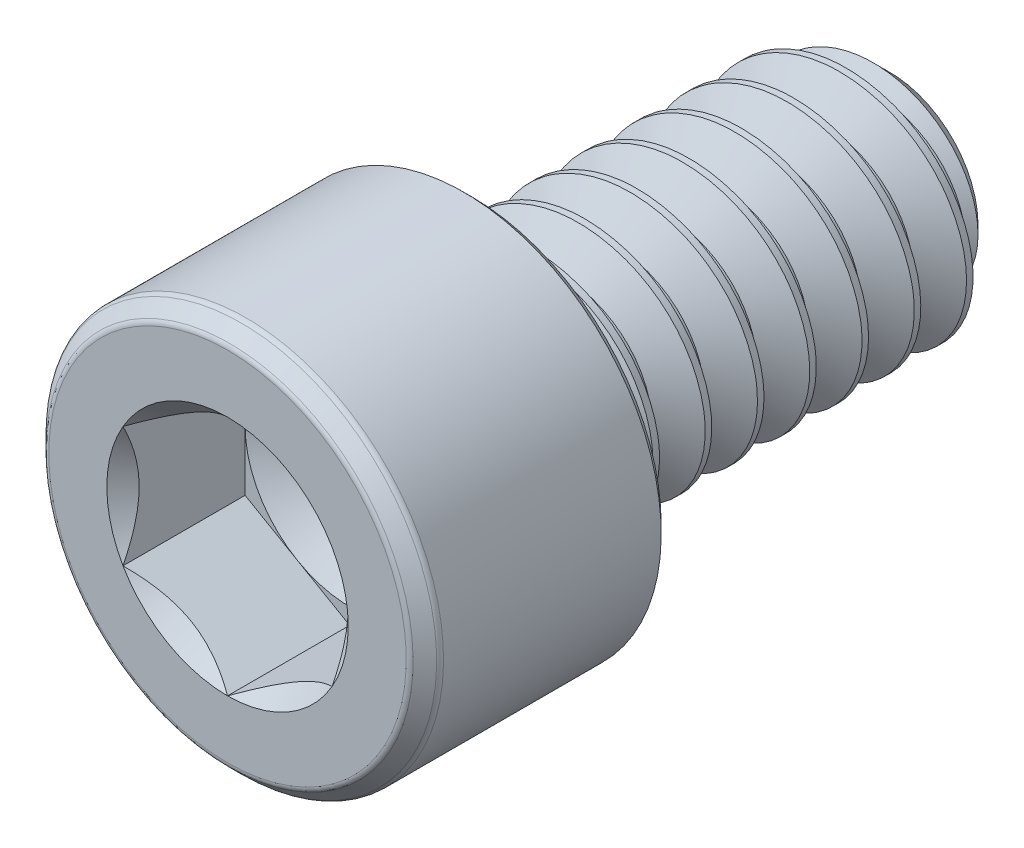
from build123d import *

# Parameters (mm, degrees)
CUT_EXTRUDE1_DEPTH = 0.9271
CUT_SWEEP1_PITCH   = 0.396875


with BuildPart() as part:
    # Sketch3 → Revolve1 (revolve)
    with BuildSketch(Plane(origin=(0, 0, 0), x_dir=(0, 0, -1), z_dir=(1, 0, 0)), mode=Mode.PRIVATE) as revolve1_sk:
        with BuildLine():
            Line((-2.5146, 1.356986084), (-2.5146, 0.79375))
            Line((-2.5146, 0.79375), (-1.5875, 0.79375))
            Line((-1.5875, 0.79375), (-1.5875, 0))
            Line((-1.5875, 0), (2.5146, 0))
            Line((2.5146, 0), (2.5146, 0.669322126))
            Line((2.5146, 0.669322126), (2.256822126, 0.9271))
            Line((2.256822126, 0.9271), (-0.5445125, 0.9271))
            ThreePointArc((-0.5445125, 0.9271), (-0.626457337, 0.961042663), (-0.6604, 1.0429875))
            Line((-0.6604, 1.0429875), (-0.6604, 1.438656))
            Line((-0.6604, 1.438656), (-0.720344, 1.4986))
            Line((-0.720344, 1.4986), (-2.372986084, 1.4986))
            ThreePointArc((-2.372986084, 1.4986), (-2.393058213, 1.494607405), (-2.410074542, 1.483237458))
            Line((-2.410074542, 1.483237458), (-2.499237458, 1.394074542))
            ThreePointArc((-2.499237458, 1.394074542), (-2.510607405, 1.377058213), (-2.5146, 1.356986084))
        make_face()
    revolve(revolve1_sk.sketch.rotate(Axis((0, 0, 2.5146), (0, 0, -1)), 180), axis=Axis((0, 0, 2.5146), (0, 0, -1)))

    # Sketch4 → Cut-Extrude1 (cut)
    with BuildSketch(Plane.XY.offset(2.5146)):
        Polygon((0, 0.916543552), (-0.79375, 0.458271776), (-0.79375, -0.458271776), (0, -0.916543552), (0.79375, -0.458271776), (0.79375, 0.458271776), align=None)
    extrude(amount=-CUT_EXTRUDE1_DEPTH, mode=Mode.SUBTRACT)

    # Cut-Extrude2 cone 1 section (through the dimple's axis) → Cut-Extrude2 (revolve, cut)
    with BuildSketch(Plane(origin=(0, 0, 2.5146), x_dir=(0, -1, 0), z_dir=(1, 0, 0))):
        Polygon((0, 0), (0.916543552, 0), (0, 0.916543552), align=None)
    revolve(axis=Axis((0, 0, 2.5146), (0, 0, -1)), mode=Mode.SUBTRACT)

    # Cut-Extrude3 cone 1 section (through the dimple's axis) → Cut-Extrude3 (revolve, cut)
    with BuildSketch(Plane(origin=(0, 0, 1.5875), x_dir=(0, -1, 0), z_dir=(1, 0, 0))):
        Polygon((0, 0), (0.79375, 0), (0, 0.458271776), align=None)
    revolve(axis=Axis((0, 0, 1.5875), (0, 0, -1)), mode=Mode.SUBTRACT)


with BuildPart() as body_2:
    # Split1: the piece on the far side of the plane
    add(part.part)
    split(bisect_by=Plane.XY.offset(0.5445125), keep=Keep.BOTTOM)

    # Cut-Sweep1: the profile of Sketch7 screwed along a right-hand helix of 9 turns, 6 arcs to a turn; built about Z, then put on its axis
    cut_sweep1_z = Axis((0, 0, 0), (0, 0, 1))
    cut_sweep1_corners = [(0.669322126, 0, -0.148828125), (0.669322126, 0, -0.1984375), (0.94858149, 0, -0.359667969), (0.94858149, 0, 0.012402344)]
    with BuildLine(mode=Mode.PRIVATE) as cut_sweep1_profile:
        Line(cut_sweep1_corners[0], cut_sweep1_corners[1])
        Line(cut_sweep1_corners[1], cut_sweep1_corners[2])
        Line(cut_sweep1_corners[2], cut_sweep1_corners[3])
        Line(cut_sweep1_corners[3], cut_sweep1_corners[0])
    cut_sweep1_cap = Face(cut_sweep1_profile.wire())
    cut_sweep1_turn_angles = [0, 30, 60, 90, 120, 150, 180, 210, 240, 270, 300, 330, 360]
    cut_sweep1_turn_weights = [1, 0.8660254037844387, 1, 0.8660254037844387, 1, 0.8660254037844387, 1, 0.8660254037844387, 1, 0.8660254037844387, 1, 0.8660254037844387, 1]
    cut_sweep1_turn_rails = [Edge.make_bspline([Vector(p[0], p[1], 0).rotate(cut_sweep1_z, cut_sweep1_turn_angles[k]) / cut_sweep1_turn_weights[k] + Vector(0, 0, p[2] + CUT_SWEEP1_PITCH * cut_sweep1_turn_angles[k] / 360) for k in range(13)], [0, 0, 0, 1, 1, 2, 2, 3, 3, 4, 4, 5, 5, 6, 6, 6], 2, cut_sweep1_turn_weights) for p in cut_sweep1_corners]
    cut_sweep1_turn_sides = [Face.make_surface_from_curves(cut_sweep1_turn_rails[p[0]], cut_sweep1_turn_rails[p[1]]) for p in [(0, 1), (1, 2), (2, 3), (3, 0)]]
    cut_sweep1 = Plane(origin=(0, 0, -2.5146), x_dir=(0, 1, 0), z_dir=(0, 0, 1)) * Solid(Shell([*[p.moved(Location((0, 0, CUT_SWEEP1_PITCH * i))) for i in range(9) for p in cut_sweep1_turn_sides], cut_sweep1_cap, cut_sweep1_cap.rotate(cut_sweep1_z, 3240).moved(Location((0, 0, CUT_SWEEP1_PITCH * 3240 / 360)))]))
    add(cut_sweep1, mode=Mode.SUBTRACT)


with BuildPart() as part_1:
    add(part.part)

    # Split1
    split(bisect_by=Plane.XY.offset(0.5445125), keep=Keep.TOP)

    add(body_2.part)  # Revolve2 merges body 2
    # Sketch11 → Revolve2 (revolve)
    with BuildSketch(Plane(origin=(0, 0, 0), x_dir=(0, 0, -1), z_dir=(1, 0, 0)), mode=Mode.PRIVATE) as revolve2_sk:
        Polygon((-0.5445125, 0.9271), (0.3825875, 0), (-1.129228224, 0), (-1.129228224, 0.9271), align=None)
    revolve(revolve2_sk.sketch.rotate(Axis((0, 0, 2.5146), (0, 0, -1)), 90), axis=Axis((0, 0, 2.5146), (0, 0, -1)))


solid = part_1.part
